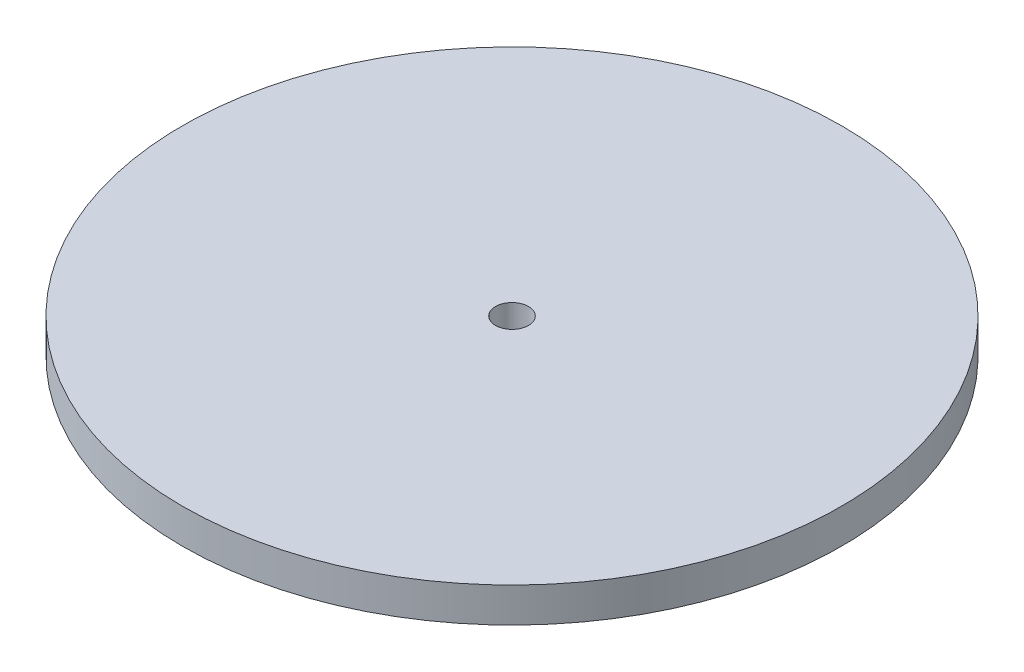
from build123d import *

# Parameters (mm, degrees)
SKETCH1_R           = 19
BOSS_EXTRUDE1_DEPTH = 2
SKETCH2_R           = 0.95
CUT_EXTRUDE1_DEPTH  = 2


with BuildPart() as part:
    # Sketch1 → Boss-Extrude1 (new body)
    with BuildSketch(Plane(origin=(0, 0, 0), x_dir=(1, 0, 0), z_dir=(0, 1, 0))):
        Circle(SKETCH1_R)
    extrude(amount=BOSS_EXTRUDE1_DEPTH)

    # Sketch2 → Cut-Extrude1 (cut)
    with BuildSketch(Plane(origin=(0, 2, 0), x_dir=(1, 0, 0), z_dir=(0, 1, 0))):
        Circle(SKETCH2_R)
    extrude(amount=-CUT_EXTRUDE1_DEPTH, mode=Mode.SUBTRACT)


solid = part.part
